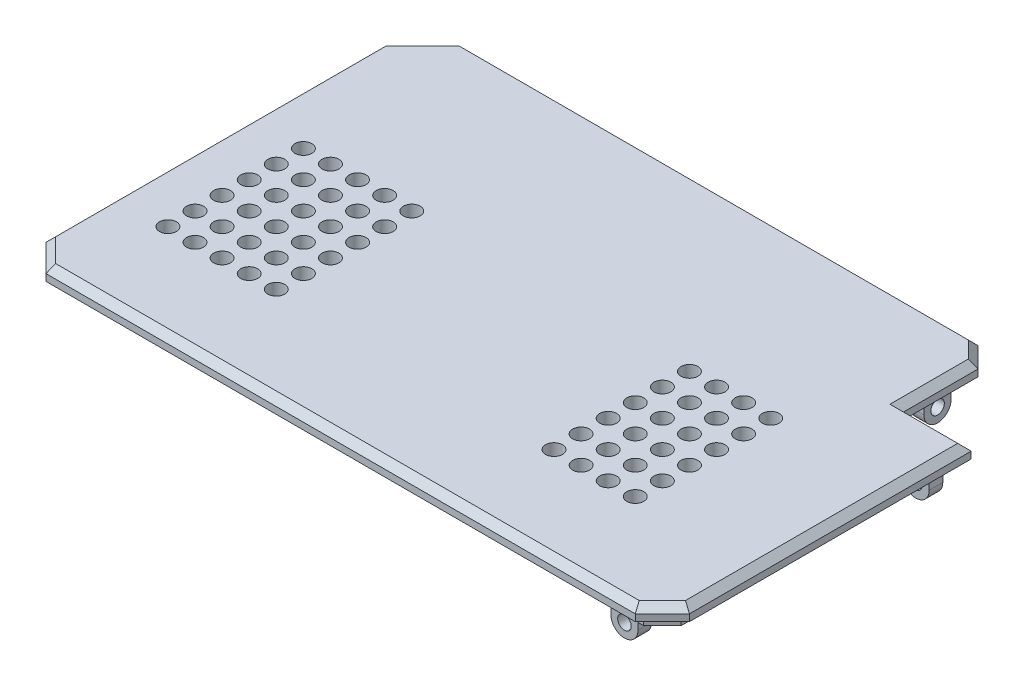
from build123d import *
from OCP.BRepFilletAPI import BRepFilletAPI_MakeChamfer

# Parameters (mm, degrees)
EXTRUDE_1_DEPTH               = 2
EXTRUDE_2_DEPTH               = 2
SKETCH_3_R                    = 1.25
CUT_EXTRUDE_1_DEPTH           = 2
SKETCH_4_W                    = 4
SKETCH_4_H                    = 2
SKETCH_4_W_2                  = 2
SKETCH_4_H_2                  = 4
EXTRUDE_3_DEPTH               = 3
FILLET_1_R                    = 2
SKETCH_5_R                    = 1
CUT_EXTRUDE_2_DEPTH           = 2
CUT_EXTRUDE_2_DRAFT           = -2
SKETCH_6_R                    = 1
CUT_EXTRUDE_3_DEPTH           = 2
CUT_EXTRUDE_3_DRAFT           = -2
SKETCH_7_R                    = 1
CUT_EXTRUDE_4_DEPTH           = 2
CUT_EXTRUDE_4_DRAFT           = -2
CUT_EXTRUDE_4_PROFILE_2_DEPTH = 2
CUT_EXTRUDE_4_PROFILE_2_DRAFT = -2
SKETCH_8_R                    = 1
CUT_EXTRUDE_5_DEPTH           = 2
CUT_EXTRUDE_5_DRAFT           = -2
SKETCH_9_R                    = 1
CUT_EXTRUDE_6_DEPTH           = 2
CUT_EXTRUDE_6_DRAFT           = -2
SKETCH_10_W                   = 2
SKETCH_10_H                   = 8
EXTRUDE_4_DEPTH               = 2.85
SKETCH_11_W                   = 2
SKETCH_11_H                   = 2.25
EXTRUDE_5_DEPTH               = 2
CHAMFER_1_SIZE                = 1
CHAMFER_1_SIZE2               = 0.700207538
SKETCH_12_W                   = 2
SKETCH_12_H                   = 4.8
EXTRUDE_6_DEPTH               = 7
CHAMFER_2_SIZE                = 1
CHAMFER_2_SIZE2               = 0.700207538
SKETCH_13_W                   = 2.9
SKETCH_13_H                   = 6
EXTRUDE_7_DEPTH               = 7
CHAMFER_3_SIZE                = 1
CHAMFER_3_SIZE2               = 0.700207538
CHAMFER_4_SIZE                = 1


with BuildPart() as part:
    # 草图1 → 凸台-拉伸1 (new body)
    with BuildSketch(Plane(origin=(0, 0, 0), x_dir=(1, 0, 0), z_dir=(0, 1, 0))):
        Polygon((-16.992801429, 40), (-16.992801429, 29), (-6.992801429, 29), (-6.992801429, -12.6), (-10.992801429, -16.6), (-97.992801429, -16.6), (-101.992801429, -12.6), (-101.992801429, 37), (-95.992801429, 43), (-19.992801429, 43), align=None)
    extrude(amount=EXTRUDE_1_DEPTH)

    # 草图2 → 凸台-拉伸2 (add)
    with BuildSketch(Plane.XZ):
        Polygon((-20.86264991, -40.9), (-19.092801429, -39.130151519), (-19.092801429, -26.9), (-9.092801429, -26.9), (-9.092801429, 11.730151519), (-11.86264991, 14.5), (-97.122952948, 14.5), (-99.892801429, 11.730151519), (-99.892801429, -36.130151519), (-95.122952948, -40.9), align=None)
        Polygon((-21.691077035, -38.9), (-21.092801429, -38.301724394), (-21.092801429, -24.9), (-11.092801429, -24.9), (-11.092801429, 10.901724394), (-12.691077035, 12.5), (-96.294525823, 12.5), (-97.892801429, 10.901724394), (-97.892801429, -35.301724394), (-94.294525823, -38.9), align=None, mode=Mode.SUBTRACT)
    extrude(amount=EXTRUDE_2_DEPTH)

    # 草图3 → 切除-拉伸1 (cut)
    with BuildSketch(Plane(origin=(0, 2, 0), x_dir=(1, 0, 0), z_dir=(0, 1, 0))):
        with Locations(Location((-36.992801429, -2.6, 0), (0, 0, 270))):
            Circle(SKETCH_3_R)
        with Locations(Location((-32.992801429, -2.6, 0), (0, 0, 270))):
            Circle(SKETCH_3_R)
        with Locations(Location((-28.992801429, -2.6, 0), (0, 0, 270))):
            Circle(SKETCH_3_R)
        with Locations(Location((-24.992801429, -2.6, 0), (0, 0, 270))):
            Circle(SKETCH_3_R)
        with Locations(Location((-32.992801429, 1.4, 0), (0, 0, 270))):
            Circle(SKETCH_3_R)
        with Locations(Location((-28.992801429, 1.4, 0), (0, 0, 270))):
            Circle(SKETCH_3_R)
        with Locations(Location((-24.992801429, 1.4, 0), (0, 0, 270))):
            Circle(SKETCH_3_R)
        with Locations(Location((-32.992801429, 5.4, 0), (0, 0, 270))):
            Circle(SKETCH_3_R)
        with Locations(Location((-28.992801429, 5.4, 0), (0, 0, 270))):
            Circle(SKETCH_3_R)
        with Locations(Location((-24.992801429, 5.4, 0), (0, 0, 270))):
            Circle(SKETCH_3_R)
        with Locations(Location((-32.992801429, 9.4, 0), (0, 0, 270))):
            Circle(SKETCH_3_R)
        with Locations(Location((-28.992801429, 9.4, 0), (0, 0, 270))):
            Circle(SKETCH_3_R)
        with Locations(Location((-24.992801429, 9.4, 0), (0, 0, 270))):
            Circle(SKETCH_3_R)
        with Locations(Location((-36.992801429, 1.4, 0), (0, 0, 270))):
            Circle(SKETCH_3_R)
        with Locations(Location((-36.992801429, 5.4, 0), (0, 0, 270))):
            Circle(SKETCH_3_R)
        with Locations(Location((-36.992801429, 9.4, 0), (0, 0, 270))):
            Circle(SKETCH_3_R)
        with Locations(Location((-36.992801429, 13.4, 0), (0, 0, 270))):
            Circle(SKETCH_3_R)
        with Locations(Location((-32.992801429, 13.4, 0), (0, 0, 270))):
            Circle(SKETCH_3_R)
        with Locations(Location((-28.992801429, 13.4, 0), (0, 0, 270))):
            Circle(SKETCH_3_R)
        with Locations(Location((-24.992801429, 13.4, 0), (0, 0, 270))):
            Circle(SKETCH_3_R)
        with Locations(Location((-36.992801429, 17.4, 0), (0, 0, 270))):
            Circle(SKETCH_3_R)
        with Locations(Location((-32.992801429, 17.4, 0), (0, 0, 270))):
            Circle(SKETCH_3_R)
        with Locations(Location((-28.992801429, 17.4, 0), (0, 0, 270))):
            Circle(SKETCH_3_R)
        with Locations(Location((-24.992801429, 17.4, 0), (0, 0, 270))):
            Circle(SKETCH_3_R)
        with Locations(Location((-93.992801429, -2.6, 0), (0, 0, 270))):
            Circle(SKETCH_3_R)
        with Locations(Location((-89.992801429, -2.6, 0), (0, 0, 270))):
            Circle(SKETCH_3_R)
        with Locations(Location((-85.992801429, -2.6, 0), (0, 0, 270))):
            Circle(SKETCH_3_R)
        with Locations(Location((-81.992801429, -2.6, 0), (0, 0, 270))):
            Circle(SKETCH_3_R)
        with Locations(Location((-77.992801429, -2.6, 0), (0, 0, 270))):
            Circle(SKETCH_3_R)
        with Locations(Location((-89.992801429, 1.4, 0), (0, 0, 270))):
            Circle(SKETCH_3_R)
        with Locations(Location((-85.992801429, 1.4, 0), (0, 0, 270))):
            Circle(SKETCH_3_R)
        with Locations(Location((-81.992801429, 1.4, 0), (0, 0, 270))):
            Circle(SKETCH_3_R)
        with Locations(Location((-77.992801429, 1.4, 0), (0, 0, 270))):
            Circle(SKETCH_3_R)
        with Locations(Location((-89.992801429, 5.4, 0), (0, 0, 270))):
            Circle(SKETCH_3_R)
        with Locations(Location((-85.992801429, 5.4, 0), (0, 0, 270))):
            Circle(SKETCH_3_R)
        with Locations(Location((-81.992801429, 5.4, 0), (0, 0, 270))):
            Circle(SKETCH_3_R)
        with Locations(Location((-77.992801429, 5.4, 0), (0, 0, 270))):
            Circle(SKETCH_3_R)
        with Locations(Location((-89.992801429, 9.4, 0), (0, 0, 270))):
            Circle(SKETCH_3_R)
        with Locations(Location((-85.992801429, 9.4, 0), (0, 0, 270))):
            Circle(SKETCH_3_R)
        with Locations(Location((-81.992801429, 9.4, 0), (0, 0, 270))):
            Circle(SKETCH_3_R)
        with Locations(Location((-77.992801429, 9.4, 0), (0, 0, 270))):
            Circle(SKETCH_3_R)
        with Locations(Location((-89.992801429, 13.4, 0), (0, 0, 270))):
            Circle(SKETCH_3_R)
        with Locations(Location((-85.992801429, 13.4, 0), (0, 0, 270))):
            Circle(SKETCH_3_R)
        with Locations(Location((-81.992801429, 13.4, 0), (0, 0, 270))):
            Circle(SKETCH_3_R)
        with Locations(Location((-77.992801429, 13.4, 0), (0, 0, 270))):
            Circle(SKETCH_3_R)
        with Locations(Location((-89.992801429, 17.4, 0), (0, 0, 270))):
            Circle(SKETCH_3_R)
        with Locations(Location((-85.992801429, 17.4, 0), (0, 0, 270))):
            Circle(SKETCH_3_R)
        with Locations(Location((-81.992801429, 17.4, 0), (0, 0, 270))):
            Circle(SKETCH_3_R)
        with Locations(Location((-77.992801429, 17.4, 0), (0, 0, 270))):
            Circle(SKETCH_3_R)
        with Locations(Location((-93.992801429, 1.4, 0), (0, 0, 270))):
            Circle(SKETCH_3_R)
        with Locations(Location((-93.992801429, 5.4, 0), (0, 0, 270))):
            Circle(SKETCH_3_R)
        with Locations(Location((-93.992801429, 9.4, 0), (0, 0, 270))):
            Circle(SKETCH_3_R)
        with Locations(Location((-93.992801429, 13.4, 0), (0, 0, 270))):
            Circle(SKETCH_3_R)
        with Locations(Location((-93.992801429, 17.4, 0), (0, 0, 270))):
            Circle(SKETCH_3_R)
    extrude(amount=-CUT_EXTRUDE_1_DEPTH, mode=Mode.SUBTRACT)

    # 草图4 → 凸台-拉伸3 (add)
    with BuildSketch(Plane.XZ.offset(2)):
        with Locations((-92.294525823, -39.9)):
            Rectangle(SKETCH_4_W, SKETCH_4_H)
        with Locations((-20.092801429, -36.127176105)):
            Rectangle(SKETCH_4_W_2, SKETCH_4_H_2)
        with Locations((-11.092801429, -25.9)):
            Rectangle(SKETCH_4_W, SKETCH_4_H)
        with Locations((-14.691077035, 13.5)):
            Rectangle(SKETCH_4_W, SKETCH_4_H)
        with Locations((-98.892801429, 8.6)):
            Rectangle(SKETCH_4_W_2, SKETCH_4_H_2)
        with Locations((-98.892801429, -33.000006224)):
            Rectangle(SKETCH_4_W_2, SKETCH_4_H_2)
    extrude(amount=EXTRUDE_3_DEPTH)

    # 圆角1
    fillet_1_edges = [part.edges().sort_by_distance(p)[0] for p in [
        (-16.691077035, -5, 13.5),
        (-12.691077035, -5, 13.5),
        (-9.092801429, -5, -25.9),
        (-13.092801429, -5, -25.9),
        (-20.092801429, -5, -38.127176105),
        (-20.092801429, -5, -34.127176105),
        (-94.294525823, -5, -39.9),
        (-90.294525823, -5, -39.9),
        (-98.892801429, -5, 10.6),
        (-98.892801429, -5, 6.6),
        (-98.892801429, -5, -35.000006224),
        (-98.892801429, -5, -31.000006224),
    ]]
    fillet(fillet_1_edges, radius=FILLET_1_R - 0.0001)  # a hair under: the kernel refuses the full size


with BuildPart() as cut_extrude_2_tool:
    # 草图5 → 切除-拉伸2 (with draft: the straight prism first)
    with BuildSketch(Plane(origin=(0, 0, -26.9), x_dir=(-1, 0, 0), z_dir=(0, 0, -1))):
        with Locations((11.092801429, -3)):
            Circle(SKETCH_5_R)
    extrude(amount=-CUT_EXTRUDE_2_DEPTH)
    # 切除-拉伸2: the draft: its side faces are tilted about the plane it starts from
    cut_extrude_2_sides = [cut_extrude_2_tool.faces().sort_by_distance(p)[0] for p in [
        (-10.092801429, -3, -25.9),
    ]]
    draft(cut_extrude_2_sides, Plane(origin=(0, 0, -26.9), x_dir=(-1, 0, 0), z_dir=(0, 0, -1)), CUT_EXTRUDE_2_DRAFT)


with BuildPart() as part_1:
    add(part.part)

    # 切除-拉伸2: cut by cut_extrude_2_tool
    add(cut_extrude_2_tool.part, mode=Mode.SUBTRACT)


with BuildPart() as cut_extrude_3_tool:
    # 草图6 → 切除-拉伸3 (with draft: the straight prism first)
    with BuildSketch(Plane.XY.offset(14.5)):
        with Locations((-14.691077035, -3)):
            Circle(SKETCH_6_R)
    extrude(amount=-CUT_EXTRUDE_3_DEPTH)
    # 切除-拉伸3: the draft: its side faces are tilted about the plane it starts from
    cut_extrude_3_sides = [cut_extrude_3_tool.faces().sort_by_distance(p)[0] for p in [
        (-15.691077035, -3, 13.5),
    ]]
    draft(cut_extrude_3_sides, Plane.XY.offset(14.5), CUT_EXTRUDE_3_DRAFT)


with BuildPart() as part_2:
    add(part_1.part)

    # 切除-拉伸3: cut by cut_extrude_3_tool
    add(cut_extrude_3_tool.part, mode=Mode.SUBTRACT)


with BuildPart() as cut_extrude_4_tool:
    # 草图7 → 切除-拉伸4 (with draft: the straight prism first)
    with BuildSketch(Plane.ZY.offset(99.892801429)):
        with Locations((8.6, -2.849972052)):
            Circle(SKETCH_7_R)
    extrude(amount=-CUT_EXTRUDE_4_DEPTH)
    # 切除-拉伸4: the draft: its side faces are tilted about the plane it starts from
    cut_extrude_4_sides = [cut_extrude_4_tool.faces().sort_by_distance(p)[0] for p in [
        (-98.892801429, -2.849972052, 7.6),
    ]]
    draft(cut_extrude_4_sides, Plane.ZY.offset(99.892801429), CUT_EXTRUDE_4_DRAFT)


with BuildPart() as part_3:
    add(part_2.part)

    # 切除-拉伸4: cut by cut_extrude_4_tool
    add(cut_extrude_4_tool.part, mode=Mode.SUBTRACT)


with BuildPart() as cut_extrude_4_profile_2_tool:
    # 草图7 → 切除-拉伸4 profile 2 (with draft: the straight prism first)
    with BuildSketch(Plane.ZY.offset(99.892801429)):
        with Locations((-33, -2.849972052)):
            Circle(SKETCH_7_R)
    extrude(amount=-CUT_EXTRUDE_4_PROFILE_2_DEPTH)
    # 切除-拉伸4 profile 2: the draft: its side faces are tilted about the plane it starts from
    cut_extrude_4_profile_2_sides = [cut_extrude_4_profile_2_tool.faces().sort_by_distance(p)[0] for p in [
        (-98.892801429, -2.849972052, -34),
    ]]
    draft(cut_extrude_4_profile_2_sides, Plane.ZY.offset(99.892801429), CUT_EXTRUDE_4_PROFILE_2_DRAFT)


with BuildPart() as part_4:
    add(part_3.part)

    # 切除-拉伸4 profile 2: cut by cut_extrude_4_profile_2_tool
    add(cut_extrude_4_profile_2_tool.part, mode=Mode.SUBTRACT)


with BuildPart() as cut_extrude_5_tool:
    # 草图8 → 切除-拉伸5 (with draft: the straight prism first)
    with BuildSketch(Plane(origin=(0, 0, -40.9), x_dir=(-1, 0, 0), z_dir=(0, 0, -1))):
        with Locations((92.294525823, -3)):
            Circle(SKETCH_8_R)
    extrude(amount=-CUT_EXTRUDE_5_DEPTH)
    # 切除-拉伸5: the draft: its side faces are tilted about the plane it starts from
    cut_extrude_5_sides = [cut_extrude_5_tool.faces().sort_by_distance(p)[0] for p in [
        (-91.294525823, -3, -39.9),
    ]]
    draft(cut_extrude_5_sides, Plane(origin=(0, 0, -40.9), x_dir=(-1, 0, 0), z_dir=(0, 0, -1)), CUT_EXTRUDE_5_DRAFT)


with BuildPart() as part_5:
    add(part_4.part)

    # 切除-拉伸5: cut by cut_extrude_5_tool
    add(cut_extrude_5_tool.part, mode=Mode.SUBTRACT)


with BuildPart() as cut_extrude_6_tool:
    # 草图9 → 切除-拉伸6 (with draft: the straight prism first)
    with BuildSketch(Plane(origin=(-19.092801429, 0, 0), x_dir=(0, 0, -1), z_dir=(1, 0, 0))):
        with Locations((36.130151519, -3)):
            Circle(SKETCH_9_R)
    extrude(amount=-CUT_EXTRUDE_6_DEPTH)
    # 切除-拉伸6: the draft: its side faces are tilted about the plane it starts from
    cut_extrude_6_sides = [cut_extrude_6_tool.faces().sort_by_distance(p)[0] for p in [
        (-20.092801429, -3, -35.130151519),
    ]]
    draft(cut_extrude_6_sides, Plane(origin=(-19.092801429, 0, 0), x_dir=(0, 0, -1), z_dir=(1, 0, 0)), CUT_EXTRUDE_6_DRAFT)


with BuildPart() as part_6:
    add(part_5.part)

    # 切除-拉伸6: cut by cut_extrude_6_tool
    add(cut_extrude_6_tool.part, mode=Mode.SUBTRACT)

    # 草图10 → 凸台-拉伸4 (add)
    with BuildSketch(Plane.XZ):
        with Locations((-70.992801429, -25)):
            Rectangle(SKETCH_10_W, SKETCH_10_H)
        with Locations((-48.992801429, -25)):
            Rectangle(SKETCH_10_W, SKETCH_10_H)
    extrude(amount=EXTRUDE_4_DEPTH)

    # 草图11 → 凸台-拉伸5 (add)
    with BuildSketch(Plane.XZ.offset(2.85)):
        with Locations((-70.992801429, -27.875)):
            Rectangle(SKETCH_11_W, SKETCH_11_H)
        with Locations((-48.992801429, -27.875)):
            Rectangle(SKETCH_11_W, SKETCH_11_H)
    extrude(amount=EXTRUDE_5_DEPTH)

    # 倒角1: one chamfer whose edges measure the first distance from different faces: ONE call of the kernel's chamfer builder (chamfer() names one face for all edges)
    chamfer_1_edges_1 = [part_6.edges().sort_by_distance(p)[0] for p in [
        (-70.992801429, -4.85, -26.75),
    ]]
    chamfer_1_side_1 = [part_6.faces().sort_by_distance(p)[0] for p in [
        (-70.992801429, -3.85, -26.75),
    ]]
    chamfer_1_edges_2 = [part_6.edges().sort_by_distance(p)[0] for p in [
        (-48.992801429, -4.85, -26.75),
    ]]
    chamfer_1_side_2 = [part_6.faces().sort_by_distance(p)[0] for p in [
        (-48.992801429, -3.85, -26.75),
    ]]
    chamfer_1 = BRepFilletAPI_MakeChamfer(part_6.part.solid().wrapped)
    for e in chamfer_1_edges_1:
        chamfer_1.Add(CHAMFER_1_SIZE, CHAMFER_1_SIZE2, e.wrapped, chamfer_1_side_1[0].wrapped)  # the first distance lies on this face
    for e in chamfer_1_edges_2:
        chamfer_1.Add(CHAMFER_1_SIZE, CHAMFER_1_SIZE2, e.wrapped, chamfer_1_side_2[0].wrapped)  # the first distance lies on this face
    add(Compound.cast(chamfer_1.Shape()), mode=Mode.REPLACE)

    # 草图12 → 凸台-拉伸6 (add)
    with BuildSketch(Plane.XZ):
        with Locations((-19.992801429, -4.5)):
            Rectangle(SKETCH_12_W, SKETCH_12_H)
    extrude(amount=EXTRUDE_6_DEPTH)

    # 倒角2
    chamfer_2_edges = [part_6.edges().sort_by_distance(p)[0] for p in [
        (-19.992801429, -7, -6.9),
    ]]
    chamfer_2_side = [part_6.faces().sort_by_distance(p)[0] for p in [
        (-19.992801429, -3.5, -6.9),
    ]]
    chamfer(chamfer_2_edges, length=CHAMFER_2_SIZE, length2=CHAMFER_2_SIZE2, reference=chamfer_2_side[0])

    # 草图13 → 凸台-拉伸7 (add)
    with BuildSketch(Plane.XZ):
        with Locations((-98.442801429, -24.4)):
            Rectangle(SKETCH_13_W, SKETCH_13_H)
    extrude(amount=EXTRUDE_7_DEPTH)

    # 倒角3
    chamfer_3_edges = [part_6.edges().sort_by_distance(p)[0] for p in [
        (-96.992801429, -7, -24.4),
    ]]
    chamfer_3_side = [part_6.faces().sort_by_distance(p)[0] for p in [
        (-96.992801429, -3.5, -24.4),
    ]]
    chamfer(chamfer_3_edges, length=CHAMFER_3_SIZE, length2=CHAMFER_3_SIZE2, reference=chamfer_3_side[0])

    # 倒角4
    chamfer_4_edges = [part_6.edges().sort_by_distance(p)[0] for p in [
        (-98.992801429, 2, -40),
        (-101.992801429, 2, -12.2),
        (-99.992801429, 2, 14.6),
        (-54.492801429, 2, 16.6),
        (-8.992801429, 2, 14.6),
        (-6.992801429, 2, -8.2),
        (-11.992801429, 2, -29),
        (-16.992801429, 2, -34.5),
        (-18.492801429, 2, -41.5),
        (-57.992801429, 2, -43),
    ]]
    chamfer(chamfer_4_edges, length=CHAMFER_4_SIZE)


solid = part_6.part
